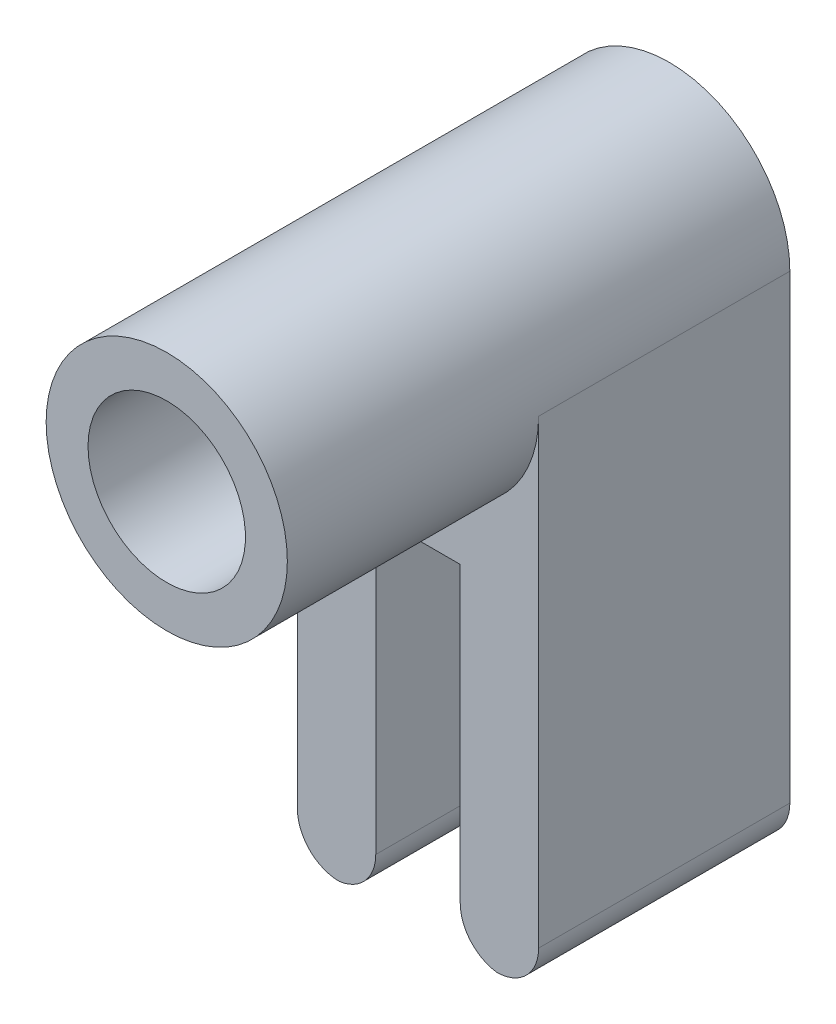
from build123d import *

# Parameters (mm, degrees)
SKETCH1_R            = 3.6576
SKETCH1_R_2          = 2.3876
BOSS_EXTRUDE1_DEPTH  = 7.62
BOSS_EXTRUDE2_START  = 7.62
BOSS_EXTRUDE2_DEPTH  = 7.62
FILLET1_R            = 1.27
SKETCH5_W            = 2.5622
SKETCH5_H            = 7.62
CUT_EXTRUDE1_DEPTH   = 10.16
FILLET2_R            = 1.27
M3_CLEARANCE_HOLE1_D = 3.6


with BuildPart() as part:
    # Sketch1 → Boss-Extrude1 (new body)
    with BuildSketch(Plane.XY):
        with Locations(Location((0, 0, 0), (0, 0, 180))):
            Circle(SKETCH1_R)
        with Locations(Location((0, 0, 0), (0, 0, 180))):
            Circle(SKETCH1_R_2, mode=Mode.SUBTRACT)
    extrude(amount=BOSS_EXTRUDE1_DEPTH)

    # Sketch4 → Boss-Extrude2 (add)
    with BuildSketch(Plane(origin=(0, 0, 0), x_dir=(-1, 0, 0), z_dir=(0, 0, -1)).offset(BOSS_EXTRUDE2_START)):
        with BuildLine():
            Line((-3.6576, 0), (-3.6576, -15.24))
            Line((-3.6576, -15.24), (3.6576, -15.24))
            Line((3.6576, -15.24), (3.6576, 0))
            ThreePointArc((3.6576, 0), (0, 3.6576), (-3.6576, 0))
        make_face()
    extrude(amount=-BOSS_EXTRUDE2_DEPTH)

    # Fillet1
    fillet1_edges = [part.edges().sort_by_distance(p)[0] for p in [
        (3.6576, -15.24, -3.81),
        (-3.6576, -15.24, -3.81),
    ]]
    fillet(fillet1_edges, radius=FILLET1_R)

    # Sketch5 → Cut-Extrude1 (cut)
    with BuildSketch(Plane.XZ.offset(15.24)):
        with Locations((0, -3.81)):
            Rectangle(SKETCH5_W, SKETCH5_H)
    extrude(amount=-CUT_EXTRUDE1_DEPTH, mode=Mode.SUBTRACT)

    # Fillet2
    # the kernel refuses this fillet: 1.27 mm, written as the material it takes off along each edge
    with BuildSketch(Plane(origin=(1.2811, -15.24, 3.148578796), x_dir=(0, 1, 0), z_dir=(0, 0, -1))) as fillet2_piece_1:
        with BuildLine():
            CenterArc((1.259431519, 1.27), FILLET2_R, 187.396796907, 82.603203093)
            Line((0, 1.1065), (-0.02518863, 1.10323))
            ThreePointArc((-0.02518863, 1.10323), (-0.0254, 0.55325), (-0.0254, 0))
            Line((-0.0254, 0), (0, -0.0254))
            Line((0, -0.0254), (1.259431519, -0.0254))
            Line((1.259431519, -0.0254), (1.259431519, 0))
        make_face()
    extrude(amount=13.917157593, mode=Mode.SUBTRACT)
    with BuildSketch(Plane(origin=(-1.2811, -15.24, -10.768578796), x_dir=(-1, 0, 0), z_dir=(0, 0, 1))) as fillet2_piece_2:
        with BuildLine():
            CenterArc((1.27, -1.259431519), FILLET2_R, 97.396796907, 82.603203093)
            Line((0, -1.259431519), (-0.0254, -1.259431519))
            Line((-0.0254, -1.259431519), (-0.0254, 0))
            Line((-0.0254, 0), (0, 0.0254))
            ThreePointArc((0, 0.0254), (0.55325, 0.0254), (1.10323, 0.02518863))
            Line((1.10323, 0.02518863), (1.1065, 0))
        make_face()
    extrude(amount=13.917157593, mode=Mode.SUBTRACT)

    # M3 Clearance Hole1 (through all)
    with Locations(Plane.XY):
        with Locations((0, 0)):
            Hole(M3_CLEARANCE_HOLE1_D / 2)


solid = part.part
